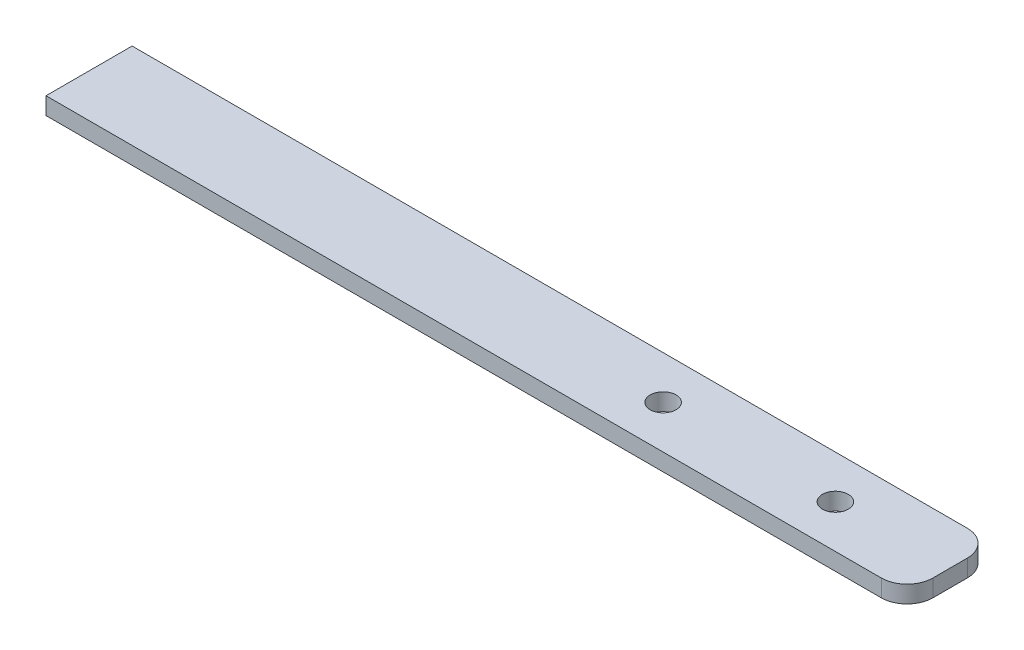
from build123d import *

# Parameters (mm, degrees)
SKETCH1_W             = 100
SKETCH1_H             = 10
BOSS_EXTRUDE1_DEPTH   = 2
FILLET1_R             = 3
F_3_0MM_DOWEL_HOLE1_D = 3


with BuildPart() as part:
    # Sketch1 → Boss-Extrude1 (new body)
    with BuildSketch(Plane(origin=(0, 0, 0), x_dir=(1, 0, 0), z_dir=(0, 1, 0))):
        Rectangle(SKETCH1_W, SKETCH1_H)
    extrude(amount=BOSS_EXTRUDE1_DEPTH)

    # Fillet1
    fillet1_edges = [part.edges().sort_by_distance(p)[0] for p in [
        (50, 1, 5),
        (50, 1, -5),
    ]]
    fillet(fillet1_edges, radius=FILLET1_R)

    # Ø3.0mm Dowel Hole1 (through all)
    with Locations(Plane(origin=(0, 2, 0), x_dir=(1, 0, 0), z_dir=(0, 1, 0))):
        with Locations((36.669467955, 0), (16.669467955, 0)):
            Hole(F_3_0MM_DOWEL_HOLE1_D / 2)


solid = part.part
